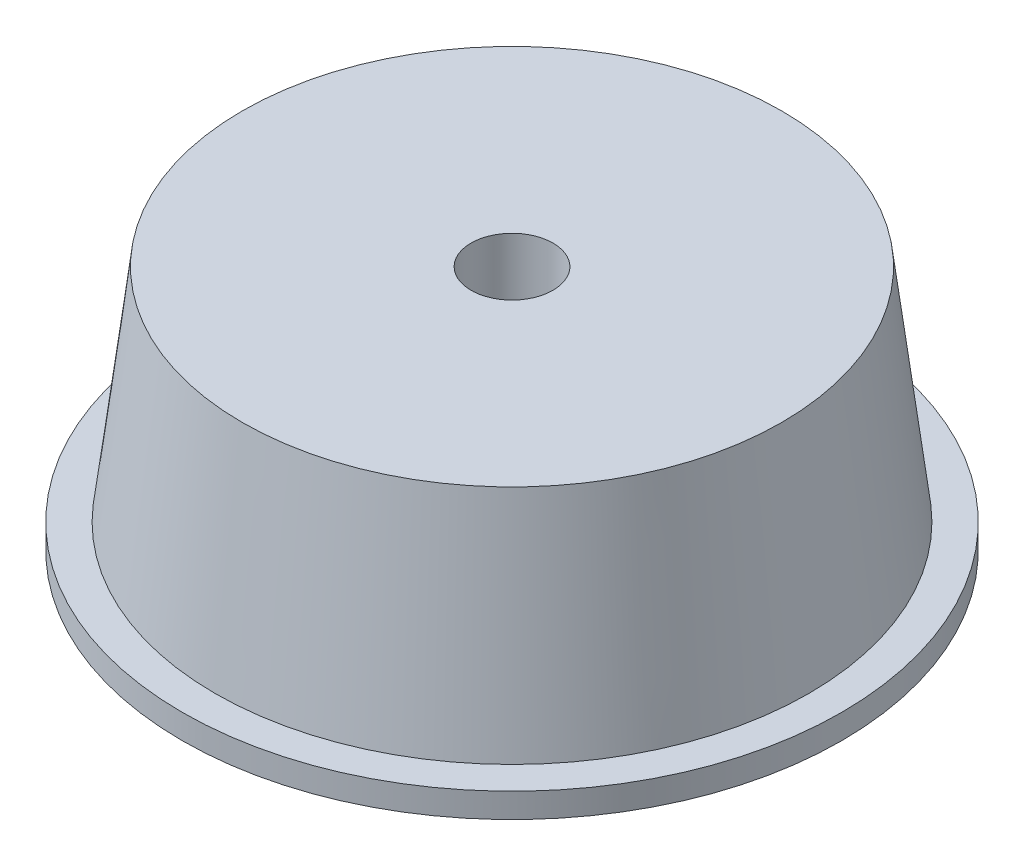
from build123d import *

# Parameters (mm, degrees)
R_VOL_MINCE1_OUTLINE_W = 0.5
R_VOL_MINCE1_OUTLINE_H = 1
CONG_2_R               = 10
CONG_3_R               = 10


# Read off the part's stored shape, not the designer's step: Révol.-Mince1
with BuildPart() as part:
    # Révol.-Mince1 outline → Révol.-Mince1 (revolve)
    with BuildSketch(Plane.XY):
        Polygon((2.5, 5), (2.5, 0), (7, 0), (7, 28), (31.169797205, 28), (34.60776491, 0), (40.254430878, 0), (40.254430878, 3), (36.254430878, 3), (32.939247734, 30), (5, 30), (5, 5), align=None)
        with Locations((4.75, 2.5)):
            Rectangle(R_VOL_MINCE1_OUTLINE_W, R_VOL_MINCE1_OUTLINE_H, mode=Mode.SUBTRACT)
    revolve(axis=Axis((0, 0, 0), (0, 1, 0)))

    # Congé2
    cong_2_edges = [part.edges().sort_by_distance(p)[0] for p in [
        (-31.169797205, 28, 0),
    ]]
    fillet(cong_2_edges, radius=CONG_2_R)

    # Congé3
    cong_3_edges = [part.edges().sort_by_distance(p)[0] for p in [
        (-7, 28, 0),
    ]]
    fillet(cong_3_edges, radius=CONG_3_R)


solid = part.part
